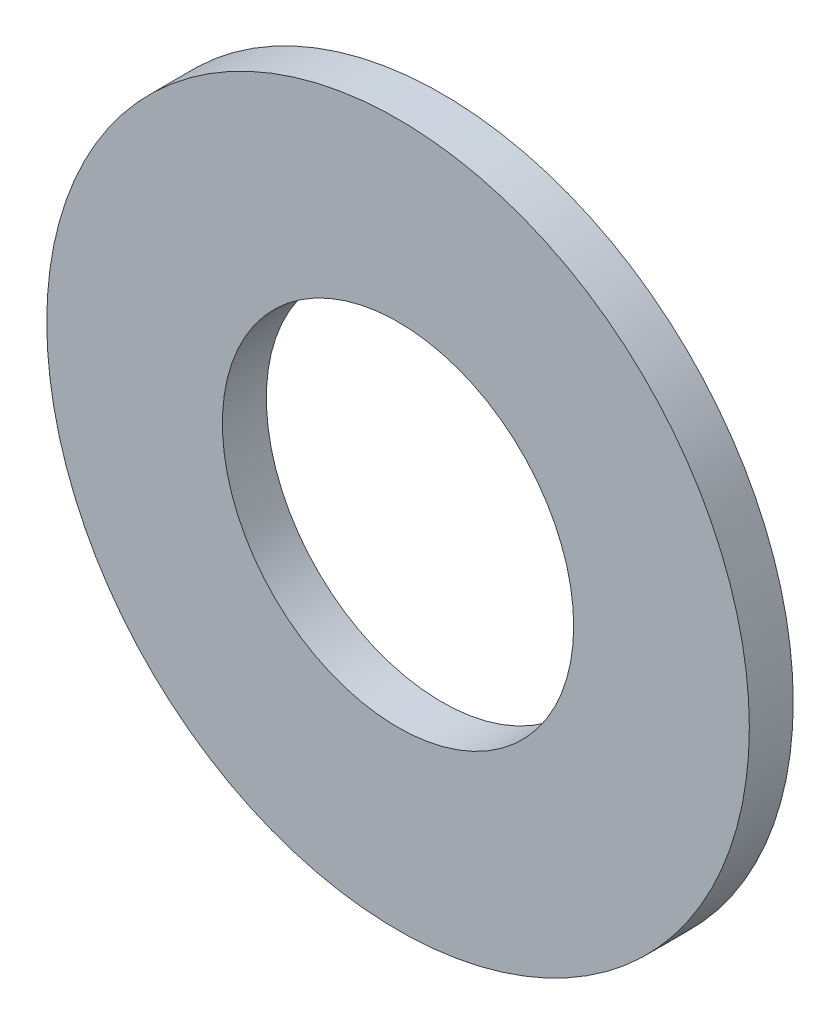
from build123d import *

# Parameters (mm, degrees)
SKETCH1_R           = 12.7
SKETCH1_R_2         = 6.35
BOSS_EXTRUDE1_DEPTH = 0.79375


with BuildPart() as part:
    # Sketch1 → Boss-Extrude1 (new, symmetric)
    with BuildSketch(Plane.XY):
        Circle(SKETCH1_R)
        Circle(SKETCH1_R_2, mode=Mode.SUBTRACT)
    extrude(amount=BOSS_EXTRUDE1_DEPTH, both=True)


solid = part.part
